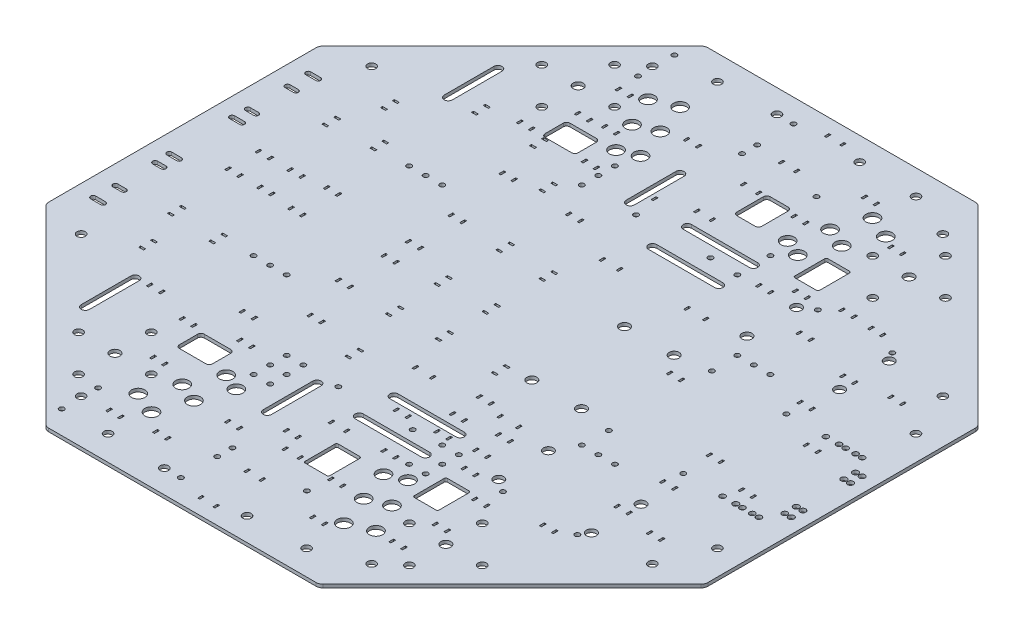
from build123d import *

# Parameters (mm, degrees)
SKETCH_1_R          = 2.5
SKETCH_1_R_2        = 1.5
SKETCH_1_R_3        = 1.65
SKETCH_1_R_4        = 1.75
SKETCH_1_R_5        = 4
SKETCH_1_R_6        = 3
SKETCH_1_W          = 1.2
SKETCH_1_H          = 3
SKETCH_1_H_2        = 2.749545417
SKETCH_1_W_2        = 3
SKETCH_1_H_3        = 1.2
EXTRUDE_1_DEPTH     = 2
CUT_EXTRUDE_1_REACH = 283.68
SKETCH_4_R          = 1.65


with BuildPart() as part:
    # 草图1 → 凸台-拉伸1 (new body)
    with BuildSketch(Plane.XZ):
        with BuildLine():
            Line((-199.172618896, 80.843145751), (-199.172618896, -80.843145751))
            ThreePointArc((-199.172618896, -80.843145751), (-198.868137026, -82.37387948), (-198.001046021, -83.671572875))
            Line((-198.001046021, -83.671572875), (-83.671572875, -198.001046021))
            ThreePointArc((-83.671572875, -198.001046021), (-82.37387948, -198.868137026), (-80.843145751, -199.172618896))
            Line((-80.843145751, -199.172618896), (80.84314575, -199.172618896))
            ThreePointArc((80.84314575, -199.172618896), (82.37387948, -198.868137026), (83.671572875, -198.001046021))
            Line((83.671572875, -198.001046021), (198.001046021, -83.671572875))
            ThreePointArc((198.001046021, -83.671572875), (198.868137026, -82.37387948), (199.172618896, -80.843145751))
            Line((199.172618896, -80.843145751), (199.172618896, 80.843145751))
            ThreePointArc((199.172618896, 80.843145751), (198.868137026, 82.37387948), (198.001046021, 83.671572875))
            Line((198.001046021, 83.671572875), (83.671572875, 198.001046021))
            ThreePointArc((83.671572875, 198.001046021), (82.37387948, 198.868137026), (80.84314575, 199.172618896))
            Line((80.84314575, 199.172618896), (-80.843145751, 199.172618896))
            ThreePointArc((-80.843145751, 199.172618896), (-82.37387948, 198.868137026), (-83.671572875, 198.001046021))
            Line((-83.671572875, 198.001046021), (-198.001046021, 83.671572875))
            ThreePointArc((-198.001046021, 83.671572875), (-198.868137026, 82.37387948), (-199.172618896, 80.843145751))
        make_face()
        with Locations((-60, 184.172618896)):
            Circle(SKETCH_1_R, mode=Mode.SUBTRACT)
        with Locations((60, 184.172618896)):
            Circle(SKETCH_1_R, mode=Mode.SUBTRACT)
        with Locations((-60, -184.172618896)):
            Circle(SKETCH_1_R, mode=Mode.SUBTRACT)
        with Locations((60, -184.172618896)):
            Circle(SKETCH_1_R, mode=Mode.SUBTRACT)
        with Locations((184.172618896, -60)):
            Circle(SKETCH_1_R, mode=Mode.SUBTRACT)
        with Locations((184.172618896, 60)):
            Circle(SKETCH_1_R, mode=Mode.SUBTRACT)
        with Locations((-87.803300859, 172.656114601)):
            Circle(SKETCH_1_R, mode=Mode.SUBTRACT)
        with Locations((-172.656114601, 87.803300859)):
            Circle(SKETCH_1_R, mode=Mode.SUBTRACT)
        with Locations((172.656114601, -87.803300859)):
            Circle(SKETCH_1_R, mode=Mode.SUBTRACT)
        with Locations((87.803300859, -172.656114601)):
            Circle(SKETCH_1_R, mode=Mode.SUBTRACT)
        with Locations((-172.656114601, -87.803300859)):
            Circle(SKETCH_1_R, mode=Mode.SUBTRACT)
        with Locations((-87.803300859, -172.656114601)):
            Circle(SKETCH_1_R, mode=Mode.SUBTRACT)
        with Locations((87.803300859, 172.656114601)):
            Circle(SKETCH_1_R, mode=Mode.SUBTRACT)
        with Locations((172.656114601, 87.803300859)):
            Circle(SKETCH_1_R, mode=Mode.SUBTRACT)
        with Locations((47, 89.172618896)):
            Circle(SKETCH_1_R_2, mode=Mode.SUBTRACT)
        with Locations((47, 109.172618896)):
            Circle(SKETCH_1_R_2, mode=Mode.SUBTRACT)
        with Locations((-47, 99.172618896)):
            Circle(SKETCH_1_R_2, mode=Mode.SUBTRACT)
        with Locations((-47, 89.172618896)):
            Circle(SKETCH_1_R_2, mode=Mode.SUBTRACT)
        with Locations((-47, 109.172618896)):
            Circle(SKETCH_1_R_2, mode=Mode.SUBTRACT)
        with Locations((99.172618896, 47)):
            Circle(SKETCH_1_R_2, mode=Mode.SUBTRACT)
        with Locations((89.172618896, 47)):
            Circle(SKETCH_1_R_2, mode=Mode.SUBTRACT)
        with Locations((109.172618896, 47)):
            Circle(SKETCH_1_R_2, mode=Mode.SUBTRACT)
        with Locations((99.172618896, -47)):
            Circle(SKETCH_1_R_2, mode=Mode.SUBTRACT)
        with Locations((89.172618896, -47)):
            Circle(SKETCH_1_R_2, mode=Mode.SUBTRACT)
        with Locations((109.172618896, -47)):
            Circle(SKETCH_1_R_2, mode=Mode.SUBTRACT)
        with Locations((-99.172618896, 47)):
            Circle(SKETCH_1_R_2, mode=Mode.SUBTRACT)
        with Locations((-89.172618896, 47)):
            Circle(SKETCH_1_R_2, mode=Mode.SUBTRACT)
        with Locations((-109.172618896, 47)):
            Circle(SKETCH_1_R_2, mode=Mode.SUBTRACT)
        with Locations((-99.172618896, -47)):
            Circle(SKETCH_1_R_2, mode=Mode.SUBTRACT)
        with Locations((-89.172618896, -47)):
            Circle(SKETCH_1_R_2, mode=Mode.SUBTRACT)
        with Locations((-109.172618896, -47)):
            Circle(SKETCH_1_R_2, mode=Mode.SUBTRACT)
        with Locations((47, -89.172618896)):
            Circle(SKETCH_1_R_2, mode=Mode.SUBTRACT)
        with Locations((47, -109.172618896)):
            Circle(SKETCH_1_R_2, mode=Mode.SUBTRACT)
        with Locations((-47, -99.172618896)):
            Circle(SKETCH_1_R_2, mode=Mode.SUBTRACT)
        with Locations((-47, -89.172618896)):
            Circle(SKETCH_1_R_2, mode=Mode.SUBTRACT)
        with Locations((-47, -109.172618896)):
            Circle(SKETCH_1_R_2, mode=Mode.SUBTRACT)
        with Locations((57, 89.172618896)):
            Circle(SKETCH_1_R_2, mode=Mode.SUBTRACT)
        with Locations((57, 99.172618896)):
            Circle(SKETCH_1_R_2, mode=Mode.SUBTRACT)
        with Locations((57, 109.172618896)):
            Circle(SKETCH_1_R_2, mode=Mode.SUBTRACT)
        with Locations((-37, 89.172618896)):
            Circle(SKETCH_1_R_2, mode=Mode.SUBTRACT)
        with Locations((-37, 99.172618896)):
            Circle(SKETCH_1_R_2, mode=Mode.SUBTRACT)
        with Locations((-37, 109.172618896)):
            Circle(SKETCH_1_R_2, mode=Mode.SUBTRACT)
        with Locations((180.472618896, -31.2)):
            Circle(SKETCH_1_R_3, mode=Mode.SUBTRACT)
        with Locations((170.472618896, -31.2)):
            Circle(SKETCH_1_R_3, mode=Mode.SUBTRACT)
        with Locations((180.472618896, 31.2)):
            Circle(SKETCH_1_R_3, mode=Mode.SUBTRACT)
        with Locations((170.472618896, 31.2)):
            Circle(SKETCH_1_R_3, mode=Mode.SUBTRACT)
        with Locations((190.232618896, -14.4)):
            Circle(SKETCH_1_R_4, mode=Mode.SUBTRACT)
        with Locations((190.232618896, -21.4)):
            Circle(SKETCH_1_R_4, mode=Mode.SUBTRACT)
        with Locations((190.232618896, 14.4)):
            Circle(SKETCH_1_R_4, mode=Mode.SUBTRACT)
        with Locations((190.232618896, 21.4)):
            Circle(SKETCH_1_R_4, mode=Mode.SUBTRACT)
        with Locations((-78, -140)):
            Circle(SKETCH_1_R, mode=Mode.SUBTRACT)
        with Locations((-100, -162)):
            Circle(SKETCH_1_R, mode=Mode.SUBTRACT)
        with Locations((-78, 140)):
            Circle(SKETCH_1_R, mode=Mode.SUBTRACT)
        with Locations((-100, 162)):
            Circle(SKETCH_1_R, mode=Mode.SUBTRACT)
        with Locations((-100, 118)):
            Circle(SKETCH_1_R, mode=Mode.SUBTRACT)
        with Locations((100, 162)):
            Circle(SKETCH_1_R, mode=Mode.SUBTRACT)
        with Locations((100, 118)):
            Circle(SKETCH_1_R, mode=Mode.SUBTRACT)
        with Locations((100, -162)):
            Circle(SKETCH_1_R, mode=Mode.SUBTRACT)
        with Locations((100, -118)):
            Circle(SKETCH_1_R, mode=Mode.SUBTRACT)
        with Locations((-100, -118)):
            Circle(SKETCH_1_R, mode=Mode.SUBTRACT)
        with Locations((-122, -140)):
            Circle(SKETCH_1_R, mode=Mode.SUBTRACT)
        with Locations((-122, 140)):
            Circle(SKETCH_1_R, mode=Mode.SUBTRACT)
        with Locations((78, 140)):
            Circle(SKETCH_1_R, mode=Mode.SUBTRACT)
        with Locations((122, 140)):
            Circle(SKETCH_1_R, mode=Mode.SUBTRACT)
        with Locations((78, -140)):
            Circle(SKETCH_1_R, mode=Mode.SUBTRACT)
        with Locations((122, -140)):
            Circle(SKETCH_1_R, mode=Mode.SUBTRACT)
        with Locations((-25, -185.172618896)):
            Circle(SKETCH_1_R, mode=Mode.SUBTRACT)
        with Locations((25, -185.172618896)):
            Circle(SKETCH_1_R, mode=Mode.SUBTRACT)
        with Locations((25, 185.172618896)):
            Circle(SKETCH_1_R, mode=Mode.SUBTRACT)
        with Locations((-25, 185.172618896)):
            Circle(SKETCH_1_R, mode=Mode.SUBTRACT)
        with Locations((-71.845104496, -154.072323796)):
            Circle(SKETCH_1_R_5, mode=Mode.SUBTRACT)
        with Locations((-63.392739261, -135.946168056)):
            Circle(SKETCH_1_R_5, mode=Mode.SUBTRACT)
        with Locations((-63.392739261, 135.946168056)):
            Circle(SKETCH_1_R_5, mode=Mode.SUBTRACT)
        with Locations((-71.845104496, 154.072323796)):
            Circle(SKETCH_1_R_5, mode=Mode.SUBTRACT)
        with Locations((63.392739261, 135.946168056)):
            Circle(SKETCH_1_R_5, mode=Mode.SUBTRACT)
        with Locations((71.845104496, 154.072323796)):
            Circle(SKETCH_1_R_5, mode=Mode.SUBTRACT)
        with Locations((71.845104496, -154.072323796)):
            Circle(SKETCH_1_R_5, mode=Mode.SUBTRACT)
        with Locations((63.392739261, -135.946168056)):
            Circle(SKETCH_1_R_5, mode=Mode.SUBTRACT)
        with Locations((-58.143424365, -159.747745534)):
            Circle(SKETCH_1_R_5, mode=Mode.SUBTRACT)
        with Locations((58.143424365, 159.747745534)):
            Circle(SKETCH_1_R_5, mode=Mode.SUBTRACT)
        with Locations((51.303021499, 140.953893118)):
            Circle(SKETCH_1_R_5, mode=Mode.SUBTRACT)
        with Locations((-58.143424365, 159.747745534)):
            Circle(SKETCH_1_R_5, mode=Mode.SUBTRACT)
        with Locations((58.143424365, -159.747745534)):
            Circle(SKETCH_1_R_5, mode=Mode.SUBTRACT)
        with Locations((51.303021499, -140.953893118)):
            Circle(SKETCH_1_R_5, mode=Mode.SUBTRACT)
        with Locations((-51.303021499, -140.953893118)):
            Circle(SKETCH_1_R_5, mode=Mode.SUBTRACT)
        with Locations((-51.303021499, 140.953893118)):
            Circle(SKETCH_1_R_5, mode=Mode.SUBTRACT)
        with Locations((54.940374026, -117.820012315)):
            Circle(SKETCH_1_R_5, mode=Mode.SUBTRACT)
        with Locations((44.462618632, -122.160040702)):
            Circle(SKETCH_1_R_5, mode=Mode.SUBTRACT)
        with Locations((-44.462618632, -122.160040702)):
            Circle(SKETCH_1_R_5, mode=Mode.SUBTRACT)
        with Locations((-54.940374026, -117.820012315)):
            Circle(SKETCH_1_R_5, mode=Mode.SUBTRACT)
        with Locations((-54.940374026, 117.820012315)):
            Circle(SKETCH_1_R_5, mode=Mode.SUBTRACT)
        with Locations((-44.462618632, 122.160040702)):
            Circle(SKETCH_1_R_5, mode=Mode.SUBTRACT)
        with Locations((44.462618632, 122.160040702)):
            Circle(SKETCH_1_R_5, mode=Mode.SUBTRACT)
        with Locations((54.940374026, 117.820012315)):
            Circle(SKETCH_1_R_5, mode=Mode.SUBTRACT)
        with Locations((40, 28)):
            Circle(SKETCH_1_R_6, mode=Mode.SUBTRACT)
        with Locations((70, 28)):
            Circle(SKETCH_1_R_6, mode=Mode.SUBTRACT)
        with Locations((40, -28)):
            Circle(SKETCH_1_R_6, mode=Mode.SUBTRACT)
        with Locations((70, -28)):
            Circle(SKETCH_1_R_6, mode=Mode.SUBTRACT)
        with Locations((30, 154)):
            Circle(SKETCH_1_R_2, mode=Mode.SUBTRACT)
        with Locations((30, 90)):
            Circle(SKETCH_1_R_2, mode=Mode.SUBTRACT)
        with Locations((-15, 90)):
            Circle(SKETCH_1_R_2, mode=Mode.SUBTRACT)
        with Locations((-15, 154)):
            Circle(SKETCH_1_R_2, mode=Mode.SUBTRACT)
        with Locations((30, -154)):
            Circle(SKETCH_1_R_2, mode=Mode.SUBTRACT)
        with Locations((30, -90)):
            Circle(SKETCH_1_R_2, mode=Mode.SUBTRACT)
        with Locations((-15, -90)):
            Circle(SKETCH_1_R_2, mode=Mode.SUBTRACT)
        with Locations((-15, -154)):
            Circle(SKETCH_1_R_2, mode=Mode.SUBTRACT)
        with Locations((186.232618896, -21.4)):
            Circle(SKETCH_1_R_4, mode=Mode.SUBTRACT)
        with Locations((186.232618896, -14.4)):
            Circle(SKETCH_1_R_4, mode=Mode.SUBTRACT)
        with Locations((186.232618896, 14.4)):
            Circle(SKETCH_1_R_4, mode=Mode.SUBTRACT)
        with Locations((186.232618896, 21.4)):
            Circle(SKETCH_1_R_3, mode=Mode.SUBTRACT)
        with Locations((176.472618896, -31.2)):
            Circle(SKETCH_1_R_3, mode=Mode.SUBTRACT)
        with Locations((176.472618896, 31.2)):
            Circle(SKETCH_1_R_3, mode=Mode.SUBTRACT)
        with Locations((166.472618896, -31.2)):
            Circle(SKETCH_1_R_3, mode=Mode.SUBTRACT)
        with Locations((166.472618896, 31.2)):
            Circle(SKETCH_1_R_4, mode=Mode.SUBTRACT)
        with Locations((-100, -140)):
            Circle(SKETCH_1_R_6, mode=Mode.SUBTRACT)
        with Locations((-100, 140)):
            Circle(SKETCH_1_R_6, mode=Mode.SUBTRACT)
        with Locations((100, 140)):
            Circle(SKETCH_1_R_6, mode=Mode.SUBTRACT)
        with Locations((100, -140)):
            Circle(SKETCH_1_R_6, mode=Mode.SUBTRACT)
        with Locations((138, 90)):
            Circle(SKETCH_1_R_6, mode=Mode.SUBTRACT)
        with Locations((82, 90)):
            Circle(SKETCH_1_R_6, mode=Mode.SUBTRACT)
        with Locations((138, 60)):
            Circle(SKETCH_1_R_6, mode=Mode.SUBTRACT)
        with Locations((82, 60)):
            Circle(SKETCH_1_R_6, mode=Mode.SUBTRACT)
        with Locations((138, -90)):
            Circle(SKETCH_1_R_6, mode=Mode.SUBTRACT)
        with Locations((82, -90)):
            Circle(SKETCH_1_R_6, mode=Mode.SUBTRACT)
        with Locations((138, -60)):
            Circle(SKETCH_1_R_6, mode=Mode.SUBTRACT)
        with Locations((82, -60)):
            Circle(SKETCH_1_R_6, mode=Mode.SUBTRACT)
        with Locations((-87, 185.172618896)):
            Circle(SKETCH_1_R_2, mode=Mode.SUBTRACT)
        with Locations((-15, 185.172618896)):
            Circle(SKETCH_1_R_2, mode=Mode.SUBTRACT)
        with Locations((-87, 163.172618896)):
            Circle(SKETCH_1_R_2, mode=Mode.SUBTRACT)
        with Locations((-15, 163.172618896)):
            Circle(SKETCH_1_R_2, mode=Mode.SUBTRACT)
        with Locations((-87, -185.172618896)):
            Circle(SKETCH_1_R_2, mode=Mode.SUBTRACT)
        with Locations((-15, -185.172618896)):
            Circle(SKETCH_1_R_2, mode=Mode.SUBTRACT)
        with Locations((-87, -163.172618896)):
            Circle(SKETCH_1_R_2, mode=Mode.SUBTRACT)
        with Locations((-15, -163.172618896)):
            Circle(SKETCH_1_R_2, mode=Mode.SUBTRACT)
        with Locations((134.672618896, 95.172618896)):
            Circle(SKETCH_1_R_2, mode=Mode.SUBTRACT)
        with Locations((134.672618896, 31.172618896)):
            Circle(SKETCH_1_R_2, mode=Mode.SUBTRACT)
        with Locations((89.672618896, 95.172618896)):
            Circle(SKETCH_1_R_2, mode=Mode.SUBTRACT)
        with Locations((89.672618896, 31.172618896)):
            Circle(SKETCH_1_R_2, mode=Mode.SUBTRACT)
        with Locations((134.672618896, -95.172618896)):
            Circle(SKETCH_1_R_2, mode=Mode.SUBTRACT)
        with Locations((134.672618896, -31.172618896)):
            Circle(SKETCH_1_R_2, mode=Mode.SUBTRACT)
        with Locations((89.672618896, -95.172618896)):
            Circle(SKETCH_1_R_2, mode=Mode.SUBTRACT)
        with Locations((89.672618896, -31.172618896)):
            Circle(SKETCH_1_R_2, mode=Mode.SUBTRACT)
        with BuildLine():
            Line((-182.172618896, 63.5), (-188.172618896, 63.5))
            ThreePointArc((-188.172618896, 63.5), (-189.672618896, 65), (-188.172618896, 66.5))
            Line((-188.172618896, 66.5), (-182.172618896, 66.5))
            ThreePointArc((-182.172618896, 66.5), (-180.672618896, 65), (-182.172618896, 63.5))
        make_face(mode=Mode.SUBTRACT)
        with BuildLine():
            Line((-182.172618896, 17.5), (-188.172618896, 17.5))
            ThreePointArc((-188.172618896, 17.5), (-189.672618896, 19), (-188.172618896, 20.5))
            Line((-188.172618896, 20.5), (-182.172618896, 20.5))
            ThreePointArc((-182.172618896, 20.5), (-180.672618896, 19), (-182.172618896, 17.5))
        make_face(mode=Mode.SUBTRACT)
        with BuildLine():
            Line((-182.172618896, -66.5), (-188.172618896, -66.5))
            ThreePointArc((-188.172618896, -66.5), (-189.672618896, -65), (-188.172618896, -63.5))
            Line((-188.172618896, -63.5), (-182.172618896, -63.5))
            ThreePointArc((-182.172618896, -63.5), (-180.672618896, -65), (-182.172618896, -66.5))
        make_face(mode=Mode.SUBTRACT)
        with BuildLine():
            Line((-182.172618896, -20.5), (-188.172618896, -20.5))
            ThreePointArc((-188.172618896, -20.5), (-189.672618896, -19), (-188.172618896, -17.5))
            Line((-188.172618896, -17.5), (-182.172618896, -17.5))
            ThreePointArc((-182.172618896, -17.5), (-180.672618896, -19), (-182.172618896, -20.5))
        make_face(mode=Mode.SUBTRACT)
        with BuildLine():
            Line((-182.672618896, 50.5), (-187.672618896, 50.5))
            ThreePointArc((-187.672618896, 50.5), (-189.172618896, 52), (-187.672618896, 53.5))
            Line((-187.672618896, 53.5), (-182.672618896, 53.5))
            ThreePointArc((-182.672618896, 53.5), (-181.172618896, 52), (-182.672618896, 50.5))
        make_face(mode=Mode.SUBTRACT)
        with BuildLine():
            Line((-182.672618896, 26.5), (-187.672618896, 26.5))
            ThreePointArc((-187.672618896, 26.5), (-189.172618896, 28), (-187.672618896, 29.5))
            Line((-187.672618896, 29.5), (-182.672618896, 29.5))
            ThreePointArc((-182.672618896, 29.5), (-181.172618896, 28), (-182.672618896, 26.5))
        make_face(mode=Mode.SUBTRACT)
        with BuildLine():
            Line((-182.672618896, -53.5), (-187.672618896, -53.5))
            ThreePointArc((-187.672618896, -53.5), (-189.172618896, -52), (-187.672618896, -50.5))
            Line((-187.672618896, -50.5), (-182.672618896, -50.5))
            ThreePointArc((-182.672618896, -50.5), (-181.172618896, -52), (-182.672618896, -53.5))
        make_face(mode=Mode.SUBTRACT)
        with BuildLine():
            Line((-182.672618896, -29.5), (-187.672618896, -29.5))
            ThreePointArc((-187.672618896, -29.5), (-189.172618896, -28), (-187.672618896, -26.5))
            Line((-187.672618896, -26.5), (-182.672618896, -26.5))
            ThreePointArc((-182.672618896, -26.5), (-181.172618896, -28), (-182.672618896, -29.5))
        make_face(mode=Mode.SUBTRACT)
        with Locations((60.6, 56.5)):
            Rectangle(SKETCH_1_W, SKETCH_1_H, mode=Mode.SUBTRACT)
        with Locations((49.4, 56.5)):
            Rectangle(SKETCH_1_W, SKETCH_1_H, mode=Mode.SUBTRACT)
        with Locations((-1.8, 56.5)):
            Rectangle(SKETCH_1_W, SKETCH_1_H, mode=Mode.SUBTRACT)
        with Locations((8.6, 56.5)):
            Rectangle(SKETCH_1_W, SKETCH_1_H, mode=Mode.SUBTRACT)
        with Locations((60.6, -56.5)):
            Rectangle(SKETCH_1_W, SKETCH_1_H, mode=Mode.SUBTRACT)
        with Locations((49.4, -56.5)):
            Rectangle(SKETCH_1_W, SKETCH_1_H, mode=Mode.SUBTRACT)
        with Locations((-1.8, -56.5)):
            Rectangle(SKETCH_1_W, SKETCH_1_H, mode=Mode.SUBTRACT)
        with Locations((8.6, -56.5)):
            Rectangle(SKETCH_1_W, SKETCH_1_H, mode=Mode.SUBTRACT)
        with Locations((10.6, -161.5)):
            Rectangle(SKETCH_1_W, SKETCH_1_H, mode=Mode.SUBTRACT)
        with Locations((1.4, -161.5)):
            Rectangle(SKETCH_1_W, SKETCH_1_H, mode=Mode.SUBTRACT)
        with Locations((10.6, -138.5)):
            Rectangle(SKETCH_1_W, SKETCH_1_H, mode=Mode.SUBTRACT)
        with Locations((1.4, -138.5)):
            Rectangle(SKETCH_1_W, SKETCH_1_H, mode=Mode.SUBTRACT)
        with Locations((10.6, -110.5)):
            Rectangle(SKETCH_1_W, SKETCH_1_H, mode=Mode.SUBTRACT)
        with Locations((1.4, -110.5)):
            Rectangle(SKETCH_1_W, SKETCH_1_H, mode=Mode.SUBTRACT)
        with Locations((10.6, -189.374772709)):
            Rectangle(SKETCH_1_W, SKETCH_1_H_2, mode=Mode.SUBTRACT)
        with Locations((1.4, -189.374772709)):
            Rectangle(SKETCH_1_W, SKETCH_1_H_2, mode=Mode.SUBTRACT)
        with Locations((10.6, 161.5)):
            Rectangle(SKETCH_1_W, SKETCH_1_H, mode=Mode.SUBTRACT)
        with Locations((1.4, 161.5)):
            Rectangle(SKETCH_1_W, SKETCH_1_H, mode=Mode.SUBTRACT)
        with Locations((10.6, 138.5)):
            Rectangle(SKETCH_1_W, SKETCH_1_H, mode=Mode.SUBTRACT)
        with Locations((1.4, 138.5)):
            Rectangle(SKETCH_1_W, SKETCH_1_H, mode=Mode.SUBTRACT)
        with Locations((10.6, 110.5)):
            Rectangle(SKETCH_1_W, SKETCH_1_H, mode=Mode.SUBTRACT)
        with Locations((1.4, 110.5)):
            Rectangle(SKETCH_1_W, SKETCH_1_H, mode=Mode.SUBTRACT)
        with Locations((10.6, 189.374772709)):
            Rectangle(SKETCH_1_W, SKETCH_1_H_2, mode=Mode.SUBTRACT)
        with Locations((1.4, 189.374772709)):
            Rectangle(SKETCH_1_W, SKETCH_1_H_2, mode=Mode.SUBTRACT)
        with Locations((-9.5, 6.6)):
            Rectangle(SKETCH_1_W_2, SKETCH_1_H_3, mode=Mode.SUBTRACT)
        with Locations((-9.5, -0.6)):
            Rectangle(SKETCH_1_W_2, SKETCH_1_H_3, mode=Mode.SUBTRACT)
        with Locations((-9.5, 27.8)):
            Rectangle(SKETCH_1_W_2, SKETCH_1_H_3, mode=Mode.SUBTRACT)
        with Locations((-9.5, 35)):
            Rectangle(SKETCH_1_W_2, SKETCH_1_H_3, mode=Mode.SUBTRACT)
        with Locations((-37.5, 29.8)):
            Rectangle(SKETCH_1_W_2, SKETCH_1_H_3, mode=Mode.SUBTRACT)
        with Locations((-37.5, 37)):
            Rectangle(SKETCH_1_W_2, SKETCH_1_H_3, mode=Mode.SUBTRACT)
        with Locations((-38.623167637, -0.6)):
            Rectangle(SKETCH_1_W_2, SKETCH_1_H_3, mode=Mode.SUBTRACT)
        with Locations((-38.623167637, 6.6)):
            Rectangle(SKETCH_1_W_2, SKETCH_1_H_3, mode=Mode.SUBTRACT)
        with Locations((-63.6, 34.078623924)):
            Rectangle(SKETCH_1_W, SKETCH_1_H, mode=Mode.SUBTRACT)
        with Locations((-70.8, 34.078623924)):
            Rectangle(SKETCH_1_W, SKETCH_1_H, mode=Mode.SUBTRACT)
        with Locations((-62.723167637, 7.363503697)):
            Rectangle(SKETCH_1_W, SKETCH_1_H, mode=Mode.SUBTRACT)
        with Locations((-69.923167637, 7.363503697)):
            Rectangle(SKETCH_1_W, SKETCH_1_H, mode=Mode.SUBTRACT)
        with Locations((-9.5, -27.8)):
            Rectangle(SKETCH_1_W_2, SKETCH_1_H_3, mode=Mode.SUBTRACT)
        with Locations((-9.5, -35)):
            Rectangle(SKETCH_1_W_2, SKETCH_1_H_3, mode=Mode.SUBTRACT)
        with Locations((-37.5, -29.8)):
            Rectangle(SKETCH_1_W_2, SKETCH_1_H_3, mode=Mode.SUBTRACT)
        with Locations((-37.5, -37)):
            Rectangle(SKETCH_1_W_2, SKETCH_1_H_3, mode=Mode.SUBTRACT)
        with Locations((-63.6, -34.078623924)):
            Rectangle(SKETCH_1_W, SKETCH_1_H, mode=Mode.SUBTRACT)
        with Locations((-70.8, -34.078623924)):
            Rectangle(SKETCH_1_W, SKETCH_1_H, mode=Mode.SUBTRACT)
        with Locations((-62.723167637, -7.363503697)):
            Rectangle(SKETCH_1_W, SKETCH_1_H, mode=Mode.SUBTRACT)
        with Locations((-69.923167637, -7.363503697)):
            Rectangle(SKETCH_1_W, SKETCH_1_H, mode=Mode.SUBTRACT)
        with Locations((139, 68.215120227)):
            Rectangle(SKETCH_1_W, SKETCH_1_H, mode=Mode.SUBTRACT)
        with Locations((131.8, 68.215120227)):
            Rectangle(SKETCH_1_W, SKETCH_1_H, mode=Mode.SUBTRACT)
        with Locations((139.876832363, 41.5)):
            Rectangle(SKETCH_1_W, SKETCH_1_H, mode=Mode.SUBTRACT)
        with Locations((132.676832363, 41.5)):
            Rectangle(SKETCH_1_W, SKETCH_1_H, mode=Mode.SUBTRACT)
        with Locations((139, -68.215120227)):
            Rectangle(SKETCH_1_W, SKETCH_1_H, mode=Mode.SUBTRACT)
        with Locations((131.8, -68.215120227)):
            Rectangle(SKETCH_1_W, SKETCH_1_H, mode=Mode.SUBTRACT)
        with Locations((139.876832363, -41.5)):
            Rectangle(SKETCH_1_W, SKETCH_1_H, mode=Mode.SUBTRACT)
        with Locations((132.676832363, -41.5)):
            Rectangle(SKETCH_1_W, SKETCH_1_H, mode=Mode.SUBTRACT)
        with Locations((-27.5, 64.2)):
            Rectangle(SKETCH_1_W_2, SKETCH_1_H_3, mode=Mode.SUBTRACT)
        with Locations((-27.5, 71.4)):
            Rectangle(SKETCH_1_W_2, SKETCH_1_H_3, mode=Mode.SUBTRACT)
        with Locations((-28.6, -70.1)):
            Rectangle(SKETCH_1_W, SKETCH_1_H, mode=Mode.SUBTRACT)
        with Locations((-35.8, -70.1)):
            Rectangle(SKETCH_1_W, SKETCH_1_H, mode=Mode.SUBTRACT)
        with Locations((-55.9, -81.4)):
            Rectangle(SKETCH_1_W_2, SKETCH_1_H_3, mode=Mode.SUBTRACT)
        with Locations((-55.9, -74.2)):
            Rectangle(SKETCH_1_W_2, SKETCH_1_H_3, mode=Mode.SUBTRACT)
        with Locations((-81.9, -101.8)):
            Rectangle(SKETCH_1_W_2, SKETCH_1_H_3, mode=Mode.SUBTRACT)
        with Locations((-81.9, -94.6)):
            Rectangle(SKETCH_1_W_2, SKETCH_1_H_3, mode=Mode.SUBTRACT)
        with Locations((-116.9, -101.681929981)):
            Rectangle(SKETCH_1_W_2, SKETCH_1_H_3, mode=Mode.SUBTRACT)
        with Locations((-116.9, -94.481929981)):
            Rectangle(SKETCH_1_W_2, SKETCH_1_H_3, mode=Mode.SUBTRACT)
        with Locations((40.8, 69.5)):
            Rectangle(SKETCH_1_W, SKETCH_1_H, mode=Mode.SUBTRACT)
        with Locations((33.6, 69.5)):
            Rectangle(SKETCH_1_W, SKETCH_1_H, mode=Mode.SUBTRACT)
        with Locations((40, 52.5)):
            Rectangle(SKETCH_1_W, SKETCH_1_H, mode=Mode.SUBTRACT)
        with Locations((32.8, 52.5)):
            Rectangle(SKETCH_1_W, SKETCH_1_H, mode=Mode.SUBTRACT)
        with Locations((25.340118078, 28.577016184)):
            Rectangle(SKETCH_1_W_2, SKETCH_1_H_3, mode=Mode.SUBTRACT)
        with Locations((25.340118078, 35.777016184)):
            Rectangle(SKETCH_1_W_2, SKETCH_1_H_3, mode=Mode.SUBTRACT)
        with Locations((-128.9, -52.281929981)):
            Rectangle(SKETCH_1_W_2, SKETCH_1_H_3, mode=Mode.SUBTRACT)
        with Locations((-128.9, -45.081929981)):
            Rectangle(SKETCH_1_W_2, SKETCH_1_H_3, mode=Mode.SUBTRACT)
        with Locations((-146.9, -76.681929981)):
            Rectangle(SKETCH_1_W_2, SKETCH_1_H_3, mode=Mode.SUBTRACT)
        with Locations((-146.9, -69.481929981)):
            Rectangle(SKETCH_1_W_2, SKETCH_1_H_3, mode=Mode.SUBTRACT)
        with Locations((-155.9, -50.281929981)):
            Rectangle(SKETCH_1_W_2, SKETCH_1_H_3, mode=Mode.SUBTRACT)
        with Locations((-155.9, -43.081929981)):
            Rectangle(SKETCH_1_W_2, SKETCH_1_H_3, mode=Mode.SUBTRACT)
        with Locations((-115.6, -10.765933076)):
            Rectangle(SKETCH_1_W, SKETCH_1_H, mode=Mode.SUBTRACT)
        with Locations((-122.8, -10.765933076)):
            Rectangle(SKETCH_1_W, SKETCH_1_H, mode=Mode.SUBTRACT)
        with Locations((-136, -9.118487536)):
            Rectangle(SKETCH_1_W, SKETCH_1_H, mode=Mode.SUBTRACT)
        with Locations((-143.2, -9.118487536)):
            Rectangle(SKETCH_1_W, SKETCH_1_H, mode=Mode.SUBTRACT)
        with Locations((-155.223337781, -9.152820459)):
            Rectangle(SKETCH_1_W, SKETCH_1_H, mode=Mode.SUBTRACT)
        with Locations((-162.423337781, -9.152820459)):
            Rectangle(SKETCH_1_W, SKETCH_1_H, mode=Mode.SUBTRACT)
        with Locations((-128.9, 52.281929981)):
            Rectangle(SKETCH_1_W_2, SKETCH_1_H_3, mode=Mode.SUBTRACT)
        with Locations((-128.9, 45.081929981)):
            Rectangle(SKETCH_1_W_2, SKETCH_1_H_3, mode=Mode.SUBTRACT)
        with Locations((-146.9, 76.681929981)):
            Rectangle(SKETCH_1_W_2, SKETCH_1_H_3, mode=Mode.SUBTRACT)
        with Locations((-146.9, 69.481929981)):
            Rectangle(SKETCH_1_W_2, SKETCH_1_H_3, mode=Mode.SUBTRACT)
        with Locations((-155.9, 50.281929981)):
            Rectangle(SKETCH_1_W_2, SKETCH_1_H_3, mode=Mode.SUBTRACT)
        with Locations((-155.9, 43.081929981)):
            Rectangle(SKETCH_1_W_2, SKETCH_1_H_3, mode=Mode.SUBTRACT)
        with Locations((-115.6, 10.765933076)):
            Rectangle(SKETCH_1_W, SKETCH_1_H, mode=Mode.SUBTRACT)
        with Locations((-122.8, 10.765933076)):
            Rectangle(SKETCH_1_W, SKETCH_1_H, mode=Mode.SUBTRACT)
        with Locations((-136, 9.118487536)):
            Rectangle(SKETCH_1_W, SKETCH_1_H, mode=Mode.SUBTRACT)
        with Locations((-143.2, 9.118487536)):
            Rectangle(SKETCH_1_W, SKETCH_1_H, mode=Mode.SUBTRACT)
        with Locations((-155.223337781, 9.152820459)):
            Rectangle(SKETCH_1_W, SKETCH_1_H, mode=Mode.SUBTRACT)
        with Locations((-162.423337781, 9.152820459)):
            Rectangle(SKETCH_1_W, SKETCH_1_H, mode=Mode.SUBTRACT)
        with Locations((139.976948344, 13.531631619)):
            Rectangle(SKETCH_1_W, SKETCH_1_H, mode=Mode.SUBTRACT)
        with Locations((132.776948344, 13.531631619)):
            Rectangle(SKETCH_1_W, SKETCH_1_H, mode=Mode.SUBTRACT)
        with Locations((126.299492909, 100.482263046)):
            Rectangle(SKETCH_1_W, SKETCH_1_H, mode=Mode.SUBTRACT)
        with Locations((119.099492909, 100.482263046)):
            Rectangle(SKETCH_1_W, SKETCH_1_H, mode=Mode.SUBTRACT)
        with Locations((122.469522139, -101.655083118)):
            Rectangle(SKETCH_1_W, SKETCH_1_H, mode=Mode.SUBTRACT)
        with Locations((115.269522139, -101.655083118)):
            Rectangle(SKETCH_1_W, SKETCH_1_H, mode=Mode.SUBTRACT)
        with Locations((-32.020008787, -144.785128669)):
            Rectangle(SKETCH_1_W, SKETCH_1_H, mode=Mode.SUBTRACT)
        with Locations((-39.220008787, -144.785128669)):
            Rectangle(SKETCH_1_W, SKETCH_1_H, mode=Mode.SUBTRACT)
        with Locations((-17.857627986, -104.041048519)):
            Rectangle(SKETCH_1_W, SKETCH_1_H, mode=Mode.SUBTRACT)
        with Locations((80.160180811, -98.356786763)):
            Rectangle(SKETCH_1_W, SKETCH_1_H, mode=Mode.SUBTRACT)
        with Locations((72.960180811, -98.356786763)):
            Rectangle(SKETCH_1_W, SKETCH_1_H, mode=Mode.SUBTRACT)
        with Locations((-62.021938526, 95.20318693)):
            Rectangle(SKETCH_1_W, SKETCH_1_H, mode=Mode.SUBTRACT)
        with Locations((-69.221938526, 95.20318693)):
            Rectangle(SKETCH_1_W, SKETCH_1_H, mode=Mode.SUBTRACT)
        with Locations((-117.990578036, 93.705242807)):
            Rectangle(SKETCH_1_W, SKETCH_1_H, mode=Mode.SUBTRACT)
        with Locations((-125.190578036, 93.705242807)):
            Rectangle(SKETCH_1_W, SKETCH_1_H, mode=Mode.SUBTRACT)
        with Locations((-53.796863522, 60.975163716)):
            Rectangle(SKETCH_1_W, SKETCH_1_H, mode=Mode.SUBTRACT)
        with Locations((-60.996863522, 60.975163716)):
            Rectangle(SKETCH_1_W, SKETCH_1_H, mode=Mode.SUBTRACT)
        with Locations((85.153029115, -17.335227281)):
            Rectangle(SKETCH_1_W, SKETCH_1_H, mode=Mode.SUBTRACT)
        with Locations((77.953029115, -17.335227281)):
            Rectangle(SKETCH_1_W, SKETCH_1_H, mode=Mode.SUBTRACT)
        with Locations((162.656743157, 72.264811108)):
            Rectangle(SKETCH_1_W, SKETCH_1_H, mode=Mode.SUBTRACT)
        with Locations((155.456743157, 72.264811108)):
            Rectangle(SKETCH_1_W, SKETCH_1_H, mode=Mode.SUBTRACT)
        with Locations((164.529173311, -71.742089822)):
            Rectangle(SKETCH_1_W, SKETCH_1_H, mode=Mode.SUBTRACT)
        with Locations((157.329173311, -71.742089822)):
            Rectangle(SKETCH_1_W, SKETCH_1_H, mode=Mode.SUBTRACT)
        with Locations((164.018510542, -21.016254743)):
            Rectangle(SKETCH_1_W, SKETCH_1_H, mode=Mode.SUBTRACT)
        with Locations((156.818510542, -21.016254743)):
            Rectangle(SKETCH_1_W, SKETCH_1_H, mode=Mode.SUBTRACT)
        with Locations((167.933591773, 22.049638798)):
            Rectangle(SKETCH_1_W, SKETCH_1_H, mode=Mode.SUBTRACT)
        with Locations((160.733591773, 22.049638798)):
            Rectangle(SKETCH_1_W, SKETCH_1_H, mode=Mode.SUBTRACT)
        with BuildLine():
            Line((66, 125), (79, 125))
            ThreePointArc((79, 125), (79.707106781, 124.707106781), (80, 124))
            Line((80, 124), (80, 106))
            ThreePointArc((80, 106), (79.707106781, 105.292893219), (79, 105))
            Line((79, 105), (66, 105))
            ThreePointArc((66, 105), (65.292893219, 105.292893219), (65, 106))
            Line((65, 106), (65, 124))
            ThreePointArc((65, 124), (65.292893219, 124.707106781), (66, 125))
        make_face(mode=Mode.SUBTRACT)
        with BuildLine():
            Line((15, 140), (28, 140))
            ThreePointArc((28, 140), (28.707106781, 139.707106781), (29, 139))
            Line((29, 139), (29, 121))
            ThreePointArc((29, 121), (28.707106781, 120.292893219), (28, 120))
            Line((28, 120), (15, 120))
            ThreePointArc((15, 120), (14.292893219, 120.292893219), (14, 121))
            Line((14, 121), (14, 139))
            ThreePointArc((14, 139), (14.292893219, 139.707106781), (15, 140))
        make_face(mode=Mode.SUBTRACT)
        with BuildLine():
            Line((66, -105), (79, -105))
            ThreePointArc((79, -105), (79.707106781, -105.292893219), (80, -106))
            Line((80, -106), (80, -124))
            ThreePointArc((80, -124), (79.707106781, -124.707106781), (79, -125))
            Line((79, -125), (66, -125))
            ThreePointArc((66, -125), (65.292893219, -124.707106781), (65, -124))
            Line((65, -124), (65, -106))
            ThreePointArc((65, -106), (65.292893219, -105.292893219), (66, -105))
        make_face(mode=Mode.SUBTRACT)
        with BuildLine():
            Line((-83, 118), (-67, 118))
            ThreePointArc((-67, 118), (-65.585786438, 117.414213562), (-65, 116))
            Line((-65, 116), (-65, 105))
            ThreePointArc((-65, 105), (-65.585786438, 103.585786438), (-67, 103))
            Line((-67, 103), (-83, 103))
            ThreePointArc((-83, 103), (-84.414213562, 103.585786438), (-85, 105))
            Line((-85, 105), (-85, 116))
            ThreePointArc((-85, 116), (-84.414213562, 117.414213562), (-83, 118))
        make_face(mode=Mode.SUBTRACT)
        with BuildLine():
            Line((-83, -103), (-67, -103))
            ThreePointArc((-67, -103), (-65.585786438, -103.585786438), (-65, -105))
            Line((-65, -105), (-65, -116))
            ThreePointArc((-65, -116), (-65.585786438, -117.414213562), (-67, -118))
            Line((-67, -118), (-83, -118))
            ThreePointArc((-83, -118), (-84.414213562, -117.414213562), (-85, -116))
            Line((-85, -116), (-85, -105))
            ThreePointArc((-85, -105), (-84.414213562, -103.585786438), (-83, -103))
        make_face(mode=Mode.SUBTRACT)
        with BuildLine():
            Line((16, -120), (27, -120))
            ThreePointArc((27, -120), (28.414213562, -120.585786438), (29, -122))
            Line((29, -122), (29, -138))
            ThreePointArc((29, -138), (28.414213562, -139.414213562), (27, -140))
            Line((27, -140), (16, -140))
            ThreePointArc((16, -140), (14.585786438, -139.414213562), (14, -138))
            Line((14, -138), (14, -122))
            ThreePointArc((14, -122), (14.585786438, -120.585786438), (16, -120))
        make_face(mode=Mode.SUBTRACT)
        with Locations((65.6, 66.5)):
            Rectangle(SKETCH_1_W, SKETCH_1_H, mode=Mode.SUBTRACT)
        with Locations((58.4, 66.5)):
            Rectangle(SKETCH_1_W, SKETCH_1_H, mode=Mode.SUBTRACT)
        with Locations((66.8, 81.5)):
            Rectangle(SKETCH_1_W, SKETCH_1_H, mode=Mode.SUBTRACT)
        with Locations((59.6, 81.5)):
            Rectangle(SKETCH_1_W, SKETCH_1_H, mode=Mode.SUBTRACT)
        with Locations((72.8, 94.5)):
            Rectangle(SKETCH_1_W, SKETCH_1_H, mode=Mode.SUBTRACT)
        with Locations((65.6, 94.5)):
            Rectangle(SKETCH_1_W, SKETCH_1_H, mode=Mode.SUBTRACT)
        with Locations((92.2, 107.5)):
            Rectangle(SKETCH_1_W, SKETCH_1_H, mode=Mode.SUBTRACT)
        with Locations((85, 107.5)):
            Rectangle(SKETCH_1_W, SKETCH_1_H, mode=Mode.SUBTRACT)
        with Locations((93.4, 132.5)):
            Rectangle(SKETCH_1_W, SKETCH_1_H, mode=Mode.SUBTRACT)
        with Locations((86.2, 132.5)):
            Rectangle(SKETCH_1_W, SKETCH_1_H, mode=Mode.SUBTRACT)
        with Locations((21.8, 84.5)):
            Rectangle(SKETCH_1_W, SKETCH_1_H, mode=Mode.SUBTRACT)
        with Locations((14.6, 84.5)):
            Rectangle(SKETCH_1_W, SKETCH_1_H, mode=Mode.SUBTRACT)
        with Locations((45.4, 83.5)):
            Rectangle(SKETCH_1_W, SKETCH_1_H, mode=Mode.SUBTRACT)
        with Locations((38.2, 83.5)):
            Rectangle(SKETCH_1_W, SKETCH_1_H, mode=Mode.SUBTRACT)
        with Locations((39.4, 109.5)):
            Rectangle(SKETCH_1_W, SKETCH_1_H, mode=Mode.SUBTRACT)
        with Locations((32.2, 109.5)):
            Rectangle(SKETCH_1_W, SKETCH_1_H, mode=Mode.SUBTRACT)
        with Locations((38.2, 140.5)):
            Rectangle(SKETCH_1_W, SKETCH_1_H, mode=Mode.SUBTRACT)
        with Locations((31, 140.5)):
            Rectangle(SKETCH_1_W, SKETCH_1_H, mode=Mode.SUBTRACT)
        with Locations((-0.698542866, 128.5)):
            Rectangle(SKETCH_1_W, SKETCH_1_H, mode=Mode.SUBTRACT)
        with Locations((-7.898542866, 128.5)):
            Rectangle(SKETCH_1_W, SKETCH_1_H, mode=Mode.SUBTRACT)
        with Locations((-23.098542866, 141.5)):
            Rectangle(SKETCH_1_W, SKETCH_1_H, mode=Mode.SUBTRACT)
        with Locations((-30.298542866, 141.5)):
            Rectangle(SKETCH_1_W, SKETCH_1_H, mode=Mode.SUBTRACT)
        with Locations((-39.498542866, 168.5)):
            Rectangle(SKETCH_1_W, SKETCH_1_H, mode=Mode.SUBTRACT)
        with Locations((-46.698542866, 168.5)):
            Rectangle(SKETCH_1_W, SKETCH_1_H, mode=Mode.SUBTRACT)
        with Locations((-64.898542866, 171.454390808)):
            Rectangle(SKETCH_1_W, SKETCH_1_H, mode=Mode.SUBTRACT)
        with Locations((-72.098542866, 171.454390808)):
            Rectangle(SKETCH_1_W, SKETCH_1_H, mode=Mode.SUBTRACT)
        with Locations((-79.298542866, 130.454390808)):
            Rectangle(SKETCH_1_W, SKETCH_1_H, mode=Mode.SUBTRACT)
        with Locations((-86.498542866, 130.454390808)):
            Rectangle(SKETCH_1_W, SKETCH_1_H, mode=Mode.SUBTRACT)
        with Locations((-90.698542866, 101.454390808)):
            Rectangle(SKETCH_1_W, SKETCH_1_H, mode=Mode.SUBTRACT)
        with Locations((-97.898542866, 101.454390808)):
            Rectangle(SKETCH_1_W, SKETCH_1_H, mode=Mode.SUBTRACT)
        with Locations((-76.298542866, 79.454390808)):
            Rectangle(SKETCH_1_W, SKETCH_1_H, mode=Mode.SUBTRACT)
        with Locations((-83.498542866, 79.454390808)):
            Rectangle(SKETCH_1_W, SKETCH_1_H, mode=Mode.SUBTRACT)
        with Locations((-78.6, -125.5)):
            Rectangle(SKETCH_1_W, SKETCH_1_H, mode=Mode.SUBTRACT)
        with Locations((-85.8, -125.5)):
            Rectangle(SKETCH_1_W, SKETCH_1_H, mode=Mode.SUBTRACT)
        with Locations((-91.565697303, -103.5)):
            Rectangle(SKETCH_1_W, SKETCH_1_H, mode=Mode.SUBTRACT)
        with Locations((-98.765697303, -103.5)):
            Rectangle(SKETCH_1_W, SKETCH_1_H, mode=Mode.SUBTRACT)
        with Locations((-70.165697303, -71.5)):
            Rectangle(SKETCH_1_W, SKETCH_1_H, mode=Mode.SUBTRACT)
        with Locations((-77.365697303, -71.5)):
            Rectangle(SKETCH_1_W, SKETCH_1_H, mode=Mode.SUBTRACT)
        with Locations((104.2, -102.5)):
            Rectangle(SKETCH_1_W, SKETCH_1_H, mode=Mode.SUBTRACT)
        with Locations((97, -102.5)):
            Rectangle(SKETCH_1_W, SKETCH_1_H, mode=Mode.SUBTRACT)
        with Locations((103.228524513, -77.5)):
            Rectangle(SKETCH_1_W, SKETCH_1_H, mode=Mode.SUBTRACT)
        with Locations((96.028524513, -77.5)):
            Rectangle(SKETCH_1_W, SKETCH_1_H, mode=Mode.SUBTRACT)
        with Locations((66.2676347, -90.19240414)):
            Rectangle(SKETCH_1_W, SKETCH_1_H, mode=Mode.SUBTRACT)
        with Locations((59.0676347, -90.19240414)):
            Rectangle(SKETCH_1_W, SKETCH_1_H, mode=Mode.SUBTRACT)
        with Locations((40.628073383, -137.054421531)):
            Rectangle(SKETCH_1_W, SKETCH_1_H, mode=Mode.SUBTRACT)
        with Locations((33.428073383, -137.054421531)):
            Rectangle(SKETCH_1_W, SKETCH_1_H, mode=Mode.SUBTRACT)
        with Locations((51.909038004, -168.359098355)):
            Rectangle(SKETCH_1_W, SKETCH_1_H, mode=Mode.SUBTRACT)
        with Locations((44.709038004, -168.359098355)):
            Rectangle(SKETCH_1_W, SKETCH_1_H, mode=Mode.SUBTRACT)
        with Locations((85.963449955, -150.203795917)):
            Rectangle(SKETCH_1_W, SKETCH_1_H, mode=Mode.SUBTRACT)
        with Locations((78.763449955, -150.203795917)):
            Rectangle(SKETCH_1_W, SKETCH_1_H, mode=Mode.SUBTRACT)
        with Locations((-78.960485143, -150.516082543)):
            Rectangle(SKETCH_1_W, SKETCH_1_H, mode=Mode.SUBTRACT)
        with Locations((-86.160485143, -150.516082543)):
            Rectangle(SKETCH_1_W, SKETCH_1_H, mode=Mode.SUBTRACT)
        with Locations((-51.547741113, -102.594544831)):
            Rectangle(SKETCH_1_W, SKETCH_1_H, mode=Mode.SUBTRACT)
        with Locations((-58.747741113, -102.594544831)):
            Rectangle(SKETCH_1_W, SKETCH_1_H, mode=Mode.SUBTRACT)
        with Locations((-63.597853815, -126.815513016)):
            Rectangle(SKETCH_1_W, SKETCH_1_H, mode=Mode.SUBTRACT)
        with Locations((-70.797853815, -126.815513016)):
            Rectangle(SKETCH_1_W, SKETCH_1_H, mode=Mode.SUBTRACT)
        with Locations((52.647909775, 165.881412146)):
            Rectangle(SKETCH_1_W, SKETCH_1_H, mode=Mode.SUBTRACT)
        with Locations((45.447909775, 165.881412146)):
            Rectangle(SKETCH_1_W, SKETCH_1_H, mode=Mode.SUBTRACT)
        with Locations((89.253346185, 154.468287499)):
            Rectangle(SKETCH_1_W, SKETCH_1_H, mode=Mode.SUBTRACT)
        with Locations((82.053346185, 154.468287499)):
            Rectangle(SKETCH_1_W, SKETCH_1_H, mode=Mode.SUBTRACT)
        with BuildLine():
            Line((6.827381104, 101.672618896), (46.827381104, 101.672618896))
            ThreePointArc((46.827381104, 101.672618896), (49.327381104, 99.172618896), (46.827381104, 96.672618896))
            Line((46.827381104, 96.672618896), (6.827381104, 96.672618896))
            ThreePointArc((6.827381104, 96.672618896), (4.327381104, 99.172618896), (6.827381104, 101.672618896))
        make_face(mode=Mode.SUBTRACT)
        with BuildLine():
            Line((46.827381104, 75.672618896), (6.827381104, 75.672618896))
            ThreePointArc((6.827381104, 75.672618896), (4.327381104, 78.172618896), (6.827381104, 80.672618896))
            Line((6.827381104, 80.672618896), (46.827381104, 80.672618896))
            ThreePointArc((46.827381104, 80.672618896), (49.327381104, 78.172618896), (46.827381104, 75.672618896))
        make_face(mode=Mode.SUBTRACT)
        with BuildLine():
            Line((6.827381104, -75.672618896), (46.827381104, -75.672618896))
            ThreePointArc((46.827381104, -75.672618896), (49.327381104, -78.172618896), (46.827381104, -80.672618896))
            Line((46.827381104, -80.672618896), (6.827381104, -80.672618896))
            ThreePointArc((6.827381104, -80.672618896), (4.327381104, -78.172618896), (6.827381104, -75.672618896))
        make_face(mode=Mode.SUBTRACT)
        with BuildLine():
            Line((-20.672618896, 124.672618896), (-20.672618896, 94.672618896))
            ThreePointArc((-20.672618896, 94.672618896), (-23.172618896, 92.172618896), (-25.672618896, 94.672618896))
            Line((-25.672618896, 94.672618896), (-25.672618896, 124.672618896))
            ThreePointArc((-25.672618896, 124.672618896), (-23.172618896, 127.172618896), (-20.672618896, 124.672618896))
        make_face(mode=Mode.SUBTRACT)
        with BuildLine():
            Line((-20.672618896, -94.672618896), (-20.672618896, -124.672618896))
            ThreePointArc((-20.672618896, -124.672618896), (-23.172618896, -127.172618896), (-25.672618896, -124.672618896))
            Line((-25.672618896, -124.672618896), (-25.672618896, -94.672618896))
            ThreePointArc((-25.672618896, -94.672618896), (-23.172618896, -92.172618896), (-20.672618896, -94.672618896))
        make_face(mode=Mode.SUBTRACT)
        with BuildLine():
            Line((-135.672618896, 94.672618896), (-135.672618896, 124.672618896))
            ThreePointArc((-135.672618896, 124.672618896), (-133.172618896, 127.172618896), (-130.672618896, 124.672618896))
            Line((-130.672618896, 124.672618896), (-130.672618896, 94.672618896))
            ThreePointArc((-130.672618896, 94.672618896), (-133.172618896, 92.172618896), (-135.672618896, 94.672618896))
        make_face(mode=Mode.SUBTRACT)
        with BuildLine():
            Line((-135.672618896, -124.672618896), (-135.672618896, -94.672618896))
            ThreePointArc((-135.672618896, -94.672618896), (-133.172618896, -92.172618896), (-130.672618896, -94.672618896))
            Line((-130.672618896, -94.672618896), (-130.672618896, -124.672618896))
            ThreePointArc((-130.672618896, -124.672618896), (-133.172618896, -127.172618896), (-135.672618896, -124.672618896))
        make_face(mode=Mode.SUBTRACT)
        with BuildLine():
            Line((6.827381104, -96.672618896), (46.827381104, -96.672618896))
            ThreePointArc((46.827381104, -96.672618896), (49.327381104, -99.172618896), (46.827381104, -101.672618896))
            Line((46.827381104, -101.672618896), (6.827381104, -101.672618896))
            ThreePointArc((6.827381104, -101.672618896), (4.327381104, -99.172618896), (6.827381104, -96.672618896))
        make_face(mode=Mode.SUBTRACT)
    extrude(amount=-EXTRUDE_1_DEPTH)

    # 草图4 → 切除-拉伸1 (cut, up to next)
    with BuildSketch(Plane.XZ, mode=Mode.PRIVATE) as cut_extrude_1_sk1:
        with Locations((158.472618896, 31.2)):
            Circle(SKETCH_4_R)
    cut_extrude_1_tool1 = extrude(cut_extrude_1_sk1.sketch, amount=-CUT_EXTRUDE_1_REACH, mode=Mode.PRIVATE) & part.part
    # 草图4 → 切除-拉伸1 (cut, up to next)
    with BuildSketch(Plane.XZ, mode=Mode.PRIVATE) as cut_extrude_1_sk2:
        with Locations((158.472618896, -31.2)):
            Circle(SKETCH_4_R)
    cut_extrude_1_tool2 = extrude(cut_extrude_1_sk2.sketch, amount=-CUT_EXTRUDE_1_REACH, mode=Mode.PRIVATE) & part.part
    add(cut_extrude_1_tool1.solids().sort_by_distance((158.472619, 0, 31.2))[0], mode=Mode.SUBTRACT)
    add(cut_extrude_1_tool2.solids().sort_by_distance((158.472619, 0, -31.2))[0], mode=Mode.SUBTRACT)


solid = part.part
